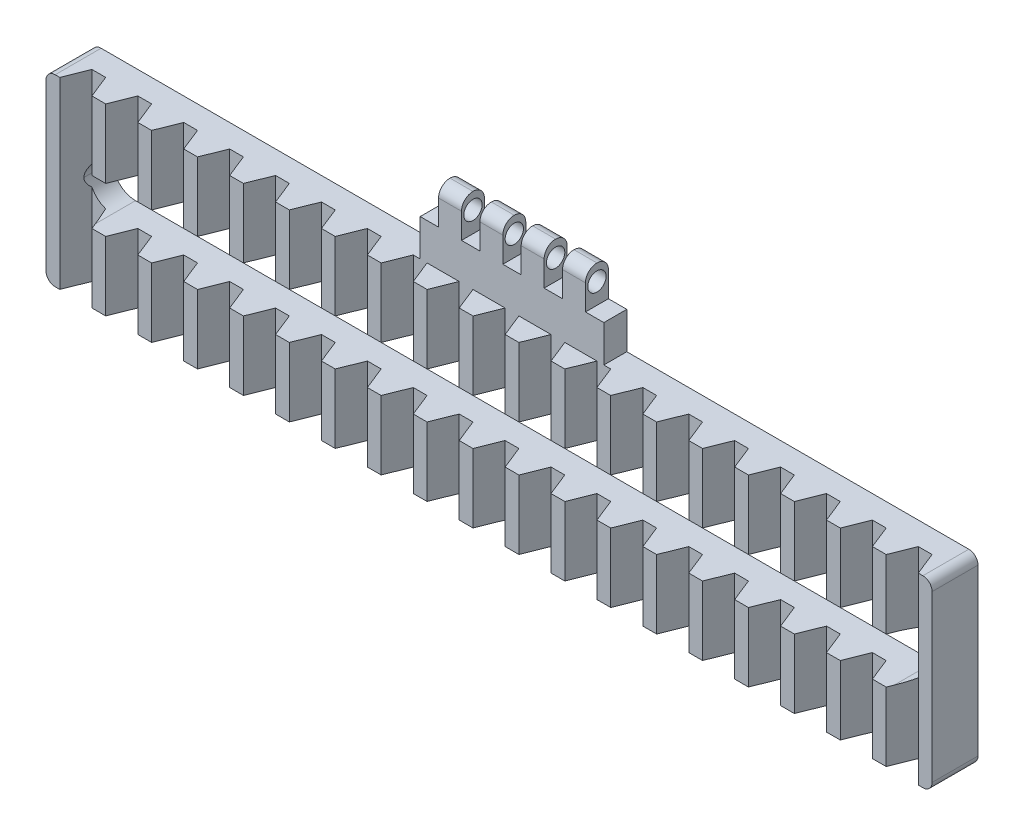
from build123d import *

# Parameters (mm, degrees)
SKETCH1_W              = 193
SKETCH1_H              = 10
BOSS_EXTRUDE1_DEPTH    = 40
CUT_EXTRUDE1_DEPTH     = 44
SKETCH3_W              = 184
SKETCH3_H              = 10
CUT_EXTRUDE2_DEPTH     = 22
FILLET1_R              = 5
SKETCH4_W              = 184
SKETCH4_H              = 5
CUT_EXTRUDE3_DEPTH     = 4
FILLET3_R              = 2
SKETCH4_4_W            = 184
SKETCH4_4_H            = 1.5
CUT_EXTRUDE4_DEPTH     = 2
FILLET4_R              = 2.5
FILLET5_R              = 4
SKETCH5_W              = 40
SKETCH5_H              = 5
BOSS_EXTRUDE2_DEPTH    = 8
SKETCH6_W              = 5
SKETCH6_H              = 5
BOSS_EXTRUDE3_DEPTH    = 8
FILLET6_R              = 2.5
LPATTERN1_COUNT        = 4
LPATTERN1_PITCH        = 9
FILLET6_OF_LPATTERN1_R = 2.5
SKETCH7_R              = 2
CUT_EXTRUDE5_DEPTH     = 126.766648997


with BuildPart() as part:
    # Sketch1 → Boss-Extrude1 (new body)
    with BuildSketch(Plane(origin=(0, 0, 0), x_dir=(1, 0, 0), z_dir=(0, 1, 0))):
        Rectangle(SKETCH1_W, SKETCH1_H)
    extrude(amount=BOSS_EXTRUDE1_DEPTH)

    # Sketch2 → Cut-Extrude1 (cut)
    with BuildSketch(Plane(origin=(0, 0, 0), x_dir=(1, 0, 0), z_dir=(0, 1, 0))):
        Polygon((-96.5, -5), (-93.5, -5), (-91.5, 0), (-88.5, 0), (-86.5, -5), (-83.5, -5), (-81.5, 0), (-78.5, 0), (-76.5, -5), (-73.5, -5), (-71.5, 0), (-68.5, 0), (-66.5, -5), (-63.5, -5), (-61.5, 0), (-58.5, 0), (-56.5, -5), (-53.5, -5), (-51.5, 0), (-48.5, 0), (-46.5, -5), (-43.5, -5), (-41.5, 0), (-38.5, 0), (-36.5, -5), (-33.5, -5), (-31.5, 0), (-28.5, 0), (-26.5, -5), (-23.5, -5), (-21.5, 0), (-18.5, 0), (-16.5, -5), (-13.5, -5), (-11.5, 0), (-8.5, 0), (-6.5, -5), (-3.5, -5), (-1.5, 0), (1.5, 0), (3.5, -5), (6.5, -5), (8.5, 0), (11.5, 0), (13.5, -5), (16.5, -5), (18.5, 0), (21.5, 0), (23.5, -5), (26.5, -5), (28.5, 0), (31.5, 0), (33.5, -5), (36.5, -5), (38.5, 0), (41.5, 0), (43.5, -5), (46.5, -5), (48.5, 0), (51.5, 0), (53.5, -5), (56.5, -5), (58.5, 0), (61.5, 0), (63.5, -5), (66.5, -5), (68.5, 0), (71.5, 0), (73.5, -5), (76.5, -5), (78.5, 0), (81.5, 0), (83.5, -5), (86.5, -5), (88.5, 0), (91.5, 0), (93.5, -5), (96.5, -5), (96.5, -20.768022812), (-96.5, -20.768022812), align=None)
    extrude(amount=CUT_EXTRUDE1_DEPTH, mode=Mode.SUBTRACT)

    # Sketch3 → Cut-Extrude2 (cut, symmetric)
    with BuildSketch(Plane.XY):
        with Locations((0, 20)):
            Rectangle(SKETCH3_W, SKETCH3_H)
    extrude(amount=CUT_EXTRUDE2_DEPTH, both=True, mode=Mode.SUBTRACT)

    # Fillet1
    fillet1_edges = [part.edges().sort_by_distance(p)[0] for p in [
        (92, 15, -1.875),
        (92, 25, -1.875),
        (-92, 15, -1.875),
        (-92, 25, -1.875),
    ]]
    fillet(fillet1_edges, radius=FILLET1_R - 0.0001)  # a hair under: the kernel refuses the full size

    # Sketch4 → Cut-Extrude3 (cut)
    with BuildSketch(Plane.XY.offset(-5)):
        with Locations((0, 32.5)):
            Rectangle(SKETCH4_W, SKETCH4_H)
        with Locations((0, 7.5)):
            Rectangle(SKETCH4_W, SKETCH4_H)
    extrude(amount=CUT_EXTRUDE3_DEPTH, mode=Mode.SUBTRACT)

    # Fillet3
    fillet3_edges = [part.edges().sort_by_distance(p)[0] for p in [
        (96.5, 40, 0),
        (-96.5, 40, 0),
        (96.5, 0, 0),
        (-96.5, 0, 0),
    ]]
    fillet(fillet3_edges, radius=FILLET3_R)

    # Sketch4<4> → Cut-Extrude4 (cut)
    with BuildSketch(Plane.XY.offset(-5)):
        with Locations((0, 35.75)):
            Rectangle(SKETCH4_4_W, SKETCH4_4_H)
        with Locations((0, 29.25)):
            Rectangle(SKETCH4_4_W, SKETCH4_4_H)
        with Locations((0, 10.75)):
            Rectangle(SKETCH4_4_W, SKETCH4_4_H)
        with Locations((0, 4.25)):
            Rectangle(SKETCH4_4_W, SKETCH4_4_H)
    extrude(amount=CUT_EXTRUDE4_DEPTH, mode=Mode.SUBTRACT)

    # Fillet4
    fillet4_edges = [part.edges().sort_by_distance(p)[0] for p in [
        (92, 35, -2),
        (92, 30, -2),
        (-92, 35, -2),
        (-92, 30, -2),
        (-92, 10, -2),
        (-92, 5, -2),
        (92, 10, -2),
        (92, 5, -2),
    ]]
    fillet(fillet4_edges, radius=FILLET4_R - 0.0001)  # a hair under: the kernel refuses the full size

    # Fillet5
    fillet5_edges = [part.edges().sort_by_distance(p)[0] for p in [
        (-92, 3.5, -4),
        (-92, 11.5, -4),
        (-92, 28.5, -4),
        (-92, 36.5, -4),
        (92, 11.5, -4),
        (92, 3.5, -4),
        (92, 28.5, -4),
        (92, 36.5, -4),
    ]]
    fillet(fillet5_edges, radius=FILLET5_R - 0.0001)  # a hair under: the kernel refuses the full size

    # Sketch5 → Boss-Extrude2 (add)
    with BuildSketch(Plane(origin=(0, 40, 0), x_dir=(1, 0, 0), z_dir=(0, 1, 0))):
        with Locations((0, 2.5)):
            Rectangle(SKETCH5_W, SKETCH5_H)
    extrude(amount=BOSS_EXTRUDE2_DEPTH)

    # Sketch6 → Boss-Extrude3 (add)
    with BuildSketch(Plane(origin=(0, 48, 0), x_dir=(1, 0, 0), z_dir=(0, 1, 0))):
        with Locations((-13.5, 2.5)):
            Rectangle(SKETCH6_W, SKETCH6_H)
    boss_extrude3 = extrude(amount=BOSS_EXTRUDE3_DEPTH)

    # Fillet6
    fillet6_edges = [part.edges().sort_by_distance(p)[0] for p in [
        (-13.5, 56, -5),
        (-13.5, 56, 0),
    ]]
    fillet(fillet6_edges, radius=FILLET6_R - 0.0001)  # a hair under: the kernel refuses the full size

    # LPattern1: Boss-Extrude3 ×4
    with Locations(*[(i * LPATTERN1_PITCH, 0, 0) for i in range(1, LPATTERN1_COUNT)]):
        add(boss_extrude3)

    # Fillet6 of LPattern1
    fillet6_of_lpattern1_edges = [part.edges().sort_by_distance(p)[0] for p in [
        (-4.5, 56, -5),
        (-4.5, 56, 0),
        (4.5, 56, -5),
        (4.5, 56, 0),
        (13.5, 56, -5),
        (13.5, 56, 0),
    ]]
    fillet(fillet6_of_lpattern1_edges, radius=FILLET6_OF_LPATTERN1_R - 0.0001)  # a hair under: the kernel refuses the full size

    # Sketch7 → Cut-Extrude5 (cut, through all)
    with BuildSketch(Plane.ZY.offset(16)):
        with Locations((-2.5, 52.5)):
            Circle(SKETCH7_R)
    extrude(amount=-CUT_EXTRUDE5_DEPTH, mode=Mode.SUBTRACT)


solid = part.part
